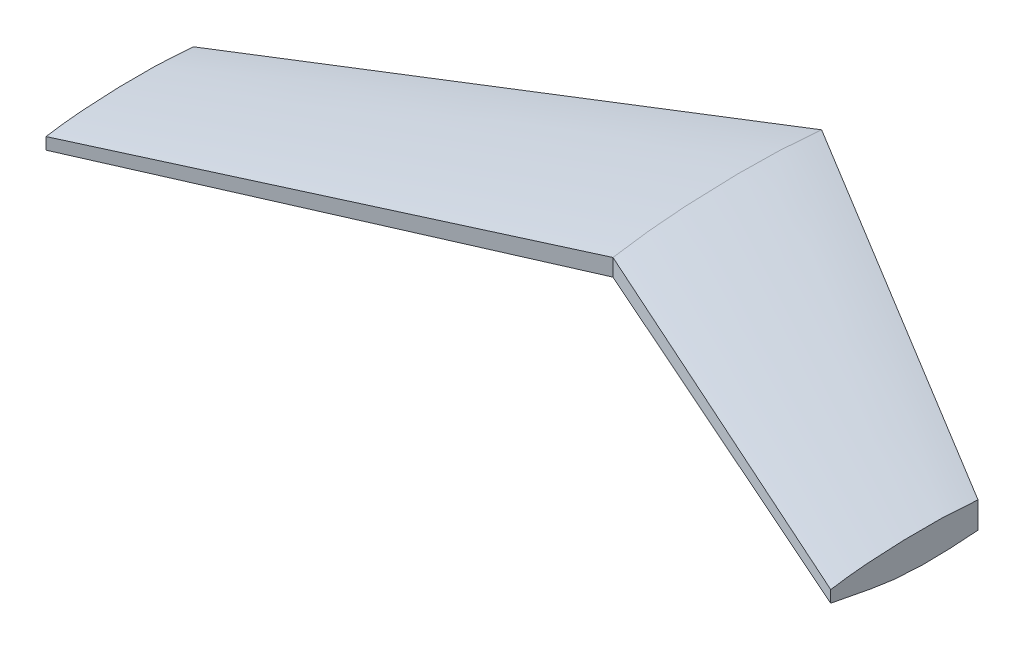
from build123d import *

# Parameters (mm, degrees)
SKETCH4_W          = 14453.89622635
SKETCH4_H          = 1933.47388346
CUT_EXTRUDE1_DEPTH = 10363.2


with BuildPart() as part:
    # Surface-Knit3: read off the stored shape, not the designer's step
    # Surface-Knit3: loft between two sections, ruled curve by curve
    surface_knit3_from = [
        Edge.make_bspline([(-18934.86083303, -33.471877701, 14035.260302209), (-18934.86083303, -39.232985839, 14002.414162771), (-18934.86083303, -47.715782252, 13953.087416618), (-18934.86083303, -58.593854823, 13887.209164739), (-18934.86083303, -66.507610448, 13837.747264713), (-18934.86083303, -74.147929788, 13788.233570957), (-18934.86083303, -81.486158392, 13738.669560406), (-18934.86083303, -88.493641805, 13689.05671), (-18934.86083303, -95.141754057, 13639.396403204), (-18934.86083303, -101.401869176, 13589.690023484), (-18934.86083303, -107.245307184, 13539.93909477), (-18934.86083303, -112.643388102, 13490.145140997), (-18934.86083303, -117.567678303, 13440.309392829), (-18934.86083303, -121.989029798, 13390.433447384), (-18934.86083303, -125.879828529, 13340.518702968), (-18934.86083303, -129.209310817, 13290.566519876), (-18934.86083303, -131.954702468, 13240.578682825), (-18934.86083303, -134.14520626, 13190.560174508), (-18934.86083303, -135.804072585, 13140.515669307), (-18934.86083303, -136.957154136, 13090.449860186), (-18934.86083303, -137.629044966, 13040.367632538), (-18934.86083303, -137.844894397, 12990.273526261), (-18934.86083303, -137.629680637, 12940.172355997), (-18934.86083303, -137.008381893, 12890.068936387), (-18934.86083303, -136.006003569, 12839.967950624), (-18934.86083303, -134.647551066, 12789.874081899), (-18934.86083303, -132.95801886, 12739.792102688), (-18934.86083303, -130.962401424, 12689.726785468), (-18934.86083303, -127.926797655, 12623.001530101), (-18934.86083303, -123.492079064, 12539.660184396), (-18934.86083303, -119.394727721, 12473.082010903), (-18934.86083303, -117.241989306, 12439.822954241)], [0, 0, 0, 0, 0.0625, 0.09375, 0.125, 0.15625, 0.1875, 0.21875, 0.25, 0.28125, 0.3125, 0.34375, 0.375, 0.40625, 0.4375, 0.46875, 0.5, 0.53125, 0.5625, 0.59375, 0.625, 0.65625, 0.6875, 0.71875, 0.75, 0.78125, 0.8125, 0.84375, 0.875, 0.9375, 1, 1, 1, 1], 3),
        Edge.make_bspline([(-18934.86083303, 120.365325484, 12439.822954241), (-18934.86083303, 122.494054894, 12473.055401614), (-18934.86083303, 126.348166334, 12539.535389158), (-18934.86083303, 130.970433248, 12639.294765427), (-18934.86083303, 134.484961546, 12739.087731356), (-18934.86083303, 136.942878492, 12838.90834322), (-18934.86083303, 138.15329091, 12922.110479008), (-18934.86083303, 138.644447388, 12988.680095077), (-18934.86083303, 138.780640496, 13038.61059056), (-18934.86083303, 138.691071829, 13088.543699188), (-18934.86083303, 138.382083573, 13138.478582735), (-18934.86083303, 137.860017912, 13188.414402975), (-18934.86083303, 137.131671681, 13238.350752055), (-18934.86083303, 136.20230149, 13288.286529831), (-18934.86083303, 135.081246142, 13338.221455349), (-18934.86083303, 133.748889114, 13388.152259432), (-18934.86083303, 132.179607267, 13438.075464594), (-18934.86083303, 130.34973447, 13487.987392083), (-18934.86083303, 128.235032848, 13537.884567717), (-18934.86083303, 125.811264523, 13587.763517313), (-18934.86083303, 122.135284813, 13654.239733934), (-18934.86083303, 116.646894642, 13737.271634153), (-18934.86083303, 108.437897072, 13836.780359182), (-18934.86083303, 98.412625908, 13936.131237745), (-18934.86083303, 90.38932828, 14002.241097744), (-18934.86083303, 86.010505038, 14035.260302209)], [0, 0, 0, 0, 0.0625, 0.125, 0.1875, 0.25, 0.3125, 0.34375, 0.375, 0.40625, 0.4375, 0.46875, 0.5, 0.53125, 0.5625, 0.59375, 0.625, 0.65625, 0.6875, 0.71875, 0.75, 0.8125, 0.875, 0.9375, 1, 1, 1, 1], 3),
        Edge.make_line((-18934.86083303, -117.241989306, 12439.822954241), (-18934.86083303, 120.365325484, 12439.822954241)),
        Edge.make_line((-18934.86083303, 86.010505038, 14035.260302209), (-18934.86083303, -33.471877701, 14035.260302209)),
    ]
    surface_knit3_to = [
        Edge.make_bspline([(0, -84.927317993, 5610.329135713), (0, -102.667137494, 5516.48325358), (0, -130.501822373, 5375.762521563), (0, -168.972896676, 5188.136309302), (0, -198.232407134, 5047.393433635), (0, -227.625131997, 4906.603749811), (0, -256.878244625, 4765.74341763), (0, -285.718671343, 4624.788710261), (0, -313.873736057, 4483.715887809), (0, -341.07008869, 4342.501145232), (0, -367.035568499, 4201.120833355), (0, -391.495939954, 4059.551011763), (0, -414.1804739, 3917.768241677), (0, -434.812449325, 3775.748222394), (0, -453.125940488, 3633.46820848), (0, -468.834062649, 3490.902433673), (0, -481.70175033, 3348.032601241), (0, -491.910608802, 3204.9004744), (0, -499.601564269, 3061.54195392), (0, -504.933479647, 2917.995523713), (0, -508.056032589, 2774.298348093), (0, -509.12376877, 2630.488284808), (0, -508.288630683, 2486.60283187), (0, -505.703960256, 2342.679659676), (0, -501.522338107, 2198.756386936), (0, -495.896769336, 2054.870573581), (0, -488.980021681, 1911.059989844), (0, -480.924976797, 1767.361947417), (0, -468.871008063, 1575.96551596), (0, -451.722002387, 1337.189173494), (0, -436.597775788, 1146.870498433), (0, -428.888194187, 1051.936712946)], [0, 0, 0, 0, 0.0625, 0.09375, 0.125, 0.15625, 0.1875, 0.21875, 0.25, 0.28125, 0.3125, 0.34375, 0.375, 0.40625, 0.4375, 0.46875, 0.5, 0.53125, 0.5625, 0.59375, 0.625, 0.65625, 0.6875, 0.71875, 0.75, 0.78125, 0.8125, 0.84375, 0.875, 0.9375, 1, 1, 1, 1], 3),
        Edge.make_bspline([(0, 423.339106489, 1051.936712946), (0, 433.430870807, 1146.759677835), (0, 451.544338374, 1336.536812968), (0, 472.84367101, 1621.537950643), (0, 488.611484269, 1906.81662352), (0, 499.187071227, 2192.314460642), (0, 503.956030141, 2430.36398482), (0, 505.514370769, 2620.854949524), (0, 505.597253239, 2763.741874097), (0, 504.636359826, 2906.63997626), (0, 502.674763974, 3049.542181379), (0, 499.753613675, 3192.441068828), (0, 495.917742322, 3335.329582719), (0, 491.204804542, 3478.200122358), (0, 485.668215769, 3621.046179455), (0, 479.262806583, 3763.854585812), (0, 471.919211522, 3906.610536852), (0, 463.577416428, 4049.299879622), (0, 454.172707472, 4191.908098118), (0, 443.642802113, 4334.420929134), (0, 428.018010365, 4524.291516807), (0, 405.357871452, 4761.319395858), (0, 372.654103084, 5045.140911431), (0, 333.933906588, 5328.235696321), (0, 303.772919031, 5516.404301316), (0, 287.521402652, 5610.329135713)], [0, 0, 0, 0, 0.0625, 0.125, 0.1875, 0.25, 0.3125, 0.34375, 0.375, 0.40625, 0.4375, 0.46875, 0.5, 0.53125, 0.5625, 0.59375, 0.625, 0.65625, 0.6875, 0.71875, 0.75, 0.8125, 0.875, 0.9375, 1, 1, 1, 1], 3),
        Edge.make_line((0, -428.888194187, 1051.936712946), (0, 423.339106489, 1051.936712946)),
        Edge.make_line((0, 287.521402652, 5610.329135713), (0, -84.927317993, 5610.329135713)),
    ]
    surface_knit3 = Solid(Shell([*[Face.make_surface_from_curves(surface_knit3_from[k], surface_knit3_to[k]) for k in range(4)], Face(Wire(surface_knit3_from)), Face(Wire(surface_knit3_to))]))
    add(surface_knit3)

    # Sketch4 → Cut-Extrude1 (cut)
    with BuildSketch(Plane(origin=(-18934.86083303, 0, 0), x_dir=(0, 0, -1), z_dir=(1, 0, 0))):
        with Locations((-7774.786517892, 36.739287504)):
            Rectangle(SKETCH4_W, SKETCH4_H)
    extrude(amount=CUT_EXTRUDE1_DEPTH, mode=Mode.SUBTRACT)

    # Mirror1: part across plane


with BuildPart() as part_1:
    add(part.part)
    add(part.part.mirror(Plane(origin=(0, 0, 0), x_dir=(0, 0, 1), z_dir=(1, 0, 0))))


solid = part_1.part
